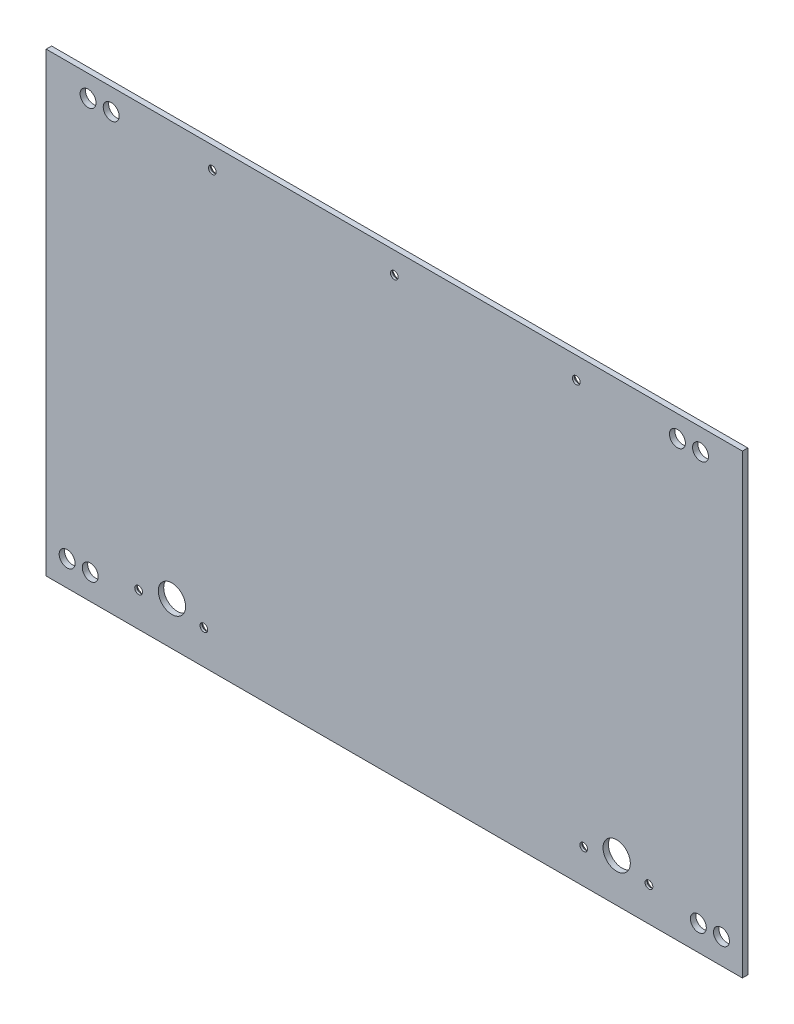
from build123d import *

# Parameters (mm, degrees)
SKETCH1_W                                      = 306.05
SKETCH1_H                                      = 197.425
BOSS_EXTRUDE1_DEPTH                            = 2.38125
SKETCH9_W                                      = 306.05
SKETCH9_H                                      = 2.38125
BOSS_EXTRUDE2_DEPTH                            = 3.175
SKETCH10_R                                     = 3.5
CUT_EXTRUDE1_DEPTH                             = 184.856965146
CSK_FOR_M3_FLAT_HEAD_MACHINE_SCREW1_AT_2_COUNT = 2
CSK_FOR_M3_FLAT_HEAD_MACHINE_SCREW1_AT_2_PITCH = 28.69
CSK_FOR_M3_FLAT_HEAD_MACHINE_SCREW1_AT_3_COUNT = 2
CSK_FOR_M3_FLAT_HEAD_MACHINE_SCREW1_AT_3_PITCH = 178.948509983
CSK_FOR_M3_FLAT_HEAD_MACHINE_SCREW1_AT_4_COUNT = 2
CSK_FOR_M3_FLAT_HEAD_MACHINE_SCREW1_AT_4_PITCH = 208.645558843
CSK_FOR_M3_FLAT_HEAD_MACHINE_SCREW1_AT_5_COUNT = 2
CSK_FOR_M3_FLAT_HEAD_MACHINE_SCREW1_AT_5_PITCH = 260.467597265
CSK_FOR_M3_FLAT_HEAD_MACHINE_SCREW1_AT_6_COUNT = 2
CSK_FOR_M3_FLAT_HEAD_MACHINE_SCREW1_AT_6_PITCH = 224.342
CSK_FOR_M3_FLAT_HEAD_MACHINE_SCREW1_AT_7_COUNT = 2
CSK_FOR_M3_FLAT_HEAD_MACHINE_SCREW1_AT_7_PITCH = 195.652
SKETCH13_R                                     = 6
CUT_EXTRUDE2_DEPTH                             = 184.856965146


with BuildPart() as part:
    # Sketch1 → Boss-Extrude1 (new body)
    with BuildSketch(Plane.XY):
        Rectangle(SKETCH1_W, SKETCH1_H)
    extrude(amount=BOSS_EXTRUDE1_DEPTH)

    # Sketch9 → Boss-Extrude2 (add)
    with BuildSketch(Plane(origin=(0, 98.7125, 0), x_dir=(1, 0, 0), z_dir=(0, 1, 0))):
        with Locations((0, -1.190625)):
            Rectangle(SKETCH9_W, SKETCH9_H)
    extrude(amount=BOSS_EXTRUDE2_DEPTH)

    # Sketch10 → Cut-Extrude1 (cut, through all)
    with BuildSketch(Plane(origin=(0, 0, 0), x_dir=(-1, 0, 0), z_dir=(0, 0, -1))):
        with Locations((-134.610000066, 92.3625001)):
            Circle(SKETCH10_R)
        with Locations((-124.450000066, 92.3625)):
            Circle(SKETCH10_R)
        with Locations((-143.817500066, -87.5375001)):
            Circle(SKETCH10_R)
        with Locations((-133.657500066, -87.537500101)):
            Circle(SKETCH10_R)
    cut_extrude1 = extrude(amount=-CUT_EXTRUDE1_DEPTH, mode=Mode.SUBTRACT)

    # Mirror1: Cut-Extrude1 across plane
    add(cut_extrude1.mirror(Plane(origin=(0, 0, 0), x_dir=(0, 0, 1), z_dir=(1, 0, 0))), mode=Mode.SUBTRACT)

    # Sketch12 → CSK for M3 Flat Head Machine Screw1 (revolve, cut)
    with BuildSketch(Plane(origin=(111.94, -83.7125, 0), x_dir=(0, 1, 0), z_dir=(1, 0, 0))):
        Polygon((0, 0), (0, 2.38125), (1.7, 2.38125), (1.7, 1.45), (3.15, 0), align=None)
    csk_for_m3_flat_head_machine_screw1 = revolve(axis=Axis((111.94, -83.7125, -6.35), (0, 0, 1)), mode=Mode.SUBTRACT)

    # CSK for M3 Flat Head Machine Screw1 at 2: CSK for M3 Flat Head Machine Screw1 ×2
    with Locations(*[(-i * CSK_FOR_M3_FLAT_HEAD_MACHINE_SCREW1_AT_2_PITCH, 0, 0) for i in range(1, CSK_FOR_M3_FLAT_HEAD_MACHINE_SCREW1_AT_2_COUNT)]):
        add(csk_for_m3_flat_head_machine_screw1, mode=Mode.SUBTRACT)

    # CSK for M3 Flat Head Machine Screw1 at 3: CSK for M3 Flat Head Machine Screw1 ×2
    with Locations(*[Vector(-0.17848709666869694, 0.9839422525345577, 0) * (i * CSK_FOR_M3_FLAT_HEAD_MACHINE_SCREW1_AT_3_PITCH) for i in range(1, CSK_FOR_M3_FLAT_HEAD_MACHINE_SCREW1_AT_3_COUNT)]):
        add(csk_for_m3_flat_head_machine_screw1, mode=Mode.SUBTRACT)

    # CSK for M3 Flat Head Machine Screw1 at 4: CSK for M3 Flat Head Machine Screw1 ×2
    with Locations(*[Vector(-0.5365079449598542, 0.8438952689729657, 0) * (i * CSK_FOR_M3_FLAT_HEAD_MACHINE_SCREW1_AT_4_PITCH) for i in range(1, CSK_FOR_M3_FLAT_HEAD_MACHINE_SCREW1_AT_4_COUNT)]):
        add(csk_for_m3_flat_head_machine_screw1, mode=Mode.SUBTRACT)

    # CSK for M3 Flat Head Machine Screw1 at 5: CSK for M3 Flat Head Machine Screw1 ×2
    with Locations(*[Vector(-0.7369054808176384, 0.6759957931384819, 0) * (i * CSK_FOR_M3_FLAT_HEAD_MACHINE_SCREW1_AT_5_PITCH) for i in range(1, CSK_FOR_M3_FLAT_HEAD_MACHINE_SCREW1_AT_5_COUNT)]):
        add(csk_for_m3_flat_head_machine_screw1, mode=Mode.SUBTRACT)

    # CSK for M3 Flat Head Machine Screw1 at 6: CSK for M3 Flat Head Machine Screw1 ×2
    with Locations(*[(-i * CSK_FOR_M3_FLAT_HEAD_MACHINE_SCREW1_AT_6_PITCH, 0, 0) for i in range(1, CSK_FOR_M3_FLAT_HEAD_MACHINE_SCREW1_AT_6_COUNT)]):
        add(csk_for_m3_flat_head_machine_screw1, mode=Mode.SUBTRACT)

    # CSK for M3 Flat Head Machine Screw1 at 7: CSK for M3 Flat Head Machine Screw1 ×2
    with Locations(*[(-i * CSK_FOR_M3_FLAT_HEAD_MACHINE_SCREW1_AT_7_PITCH, 0, 0) for i in range(1, CSK_FOR_M3_FLAT_HEAD_MACHINE_SCREW1_AT_7_COUNT)]):
        add(csk_for_m3_flat_head_machine_screw1, mode=Mode.SUBTRACT)

    # Sketch13 → Cut-Extrude2 (cut, through all)
    with BuildSketch(Plane(origin=(0, 0, 0), x_dir=(-1, 0, 0), z_dir=(0, 0, -1))):
        with Locations((-97.75, -79.7125001)):
            Circle(SKETCH13_R)
        with Locations((97.75, -79.7125001)):
            Circle(SKETCH13_R)
    extrude(amount=-CUT_EXTRUDE2_DEPTH, mode=Mode.SUBTRACT)


solid = part.part
